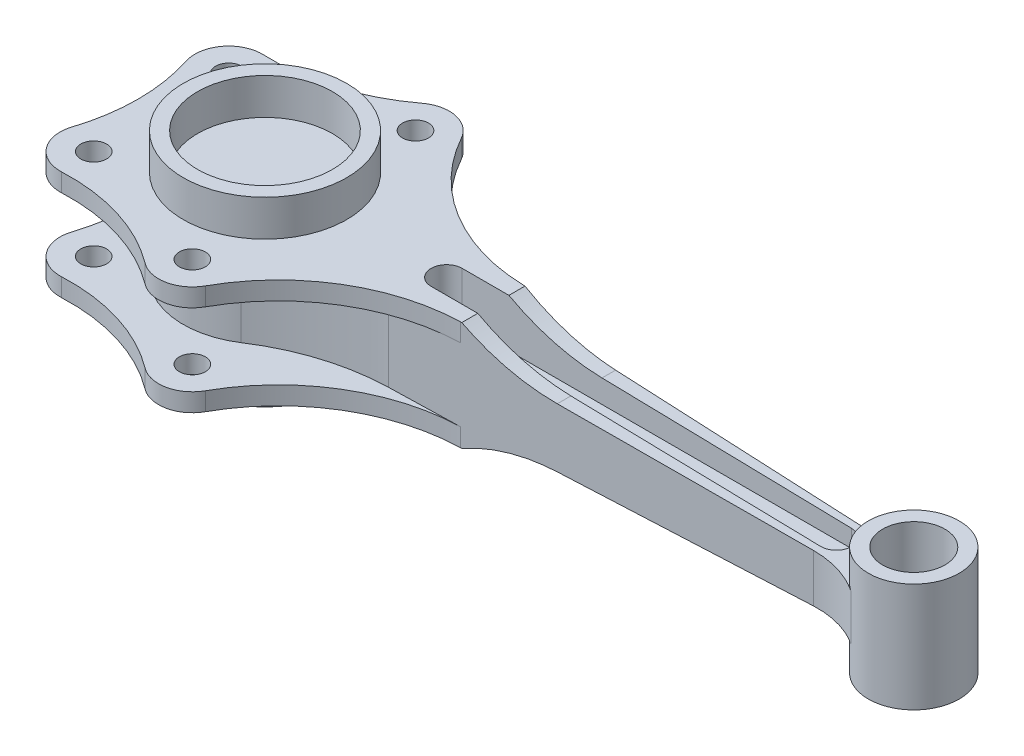
from build123d import *
from build123d.topology import SkipClean

# Parameters (mm, degrees)
BOSS_EXTRUDE1_DEPTH = 21
SKETCH2_R           = 12
CUT_EXTRUDE1_DEPTH  = 21
SKETCH3_R           = 26
CUT_EXTRUDE2_DEPTH  = 273.603191471
SKETCH5_R           = 31.5
SKETCH5_R_2         = 26
BOSS_EXTRUDE2_DEPTH = 35
SKETCH4_R           = 5
BOSS_EXTRUDE3_DEPTH = 7
CUT_EXTRUDE3_DEPTH  = 20
CUT_EXTRUDE5_REACH  = 280.977
CUT_EXTRUDE6_REACH  = 280.977
CUT_EXTRUDE7_START  = -2.5
CUT_EXTRUDE7_DEPTH  = 274.030851267


with BuildPart() as part:
    # Sketch1 → Boss-Extrude1 (new, symmetric)
    with BuildSketch(Plane(origin=(0, 0, 0), x_dir=(1, 0, 0), z_dir=(0, 1, 0))):
        with BuildLine():
            Line((60.430871603, 12.898377286), (220, 8.719912605))
            ThreePointArc((220, 8.719912605), (230.604685788, 10.075596562), (240.30539773, 14.569306326))
            ThreePointArc((240.30539773, 14.569306326), (267.5, 0), (240.30539773, -14.569306326))
            ThreePointArc((240.30539773, -14.569306326), (230.604685788, -10.075596562), (220, -8.719912605))
            Line((220, -8.719912605), (60.430871603, -12.898377286))
            ThreePointArc((60.430871603, -12.898377286), (37.890504435, -16.634432055), (17.222812986, -26.374698346))
            ThreePointArc((17.222812986, -26.374698346), (-31.5, 0), (17.222812986, 26.374698346))
            ThreePointArc((17.222812986, 26.374698346), (37.890504435, 16.634432055), (60.430871603, 12.898377286))
        make_face()
    extrude(amount=BOSS_EXTRUDE1_DEPTH, both=True)

    # Sketch2 → Cut-Extrude1 (cut, symmetric)
    with BuildSketch(Plane(origin=(0, 0, 0), x_dir=(1, 0, 0), z_dir=(0, 1, 0))):
        with Locations((250, 0)):
            Circle(SKETCH2_R)
    extrude(amount=CUT_EXTRUDE1_DEPTH, both=True, mode=Mode.SUBTRACT)

    # Sketch3 → Cut-Extrude2 (cut, through all)
    with BuildSketch(Plane.XZ.offset(21)):
        Circle(SKETCH3_R)
    extrude(amount=-CUT_EXTRUDE2_DEPTH, mode=Mode.SUBTRACT)

    # Sketch5 → Boss-Extrude2 (add, symmetric)
    with BuildSketch(Plane(origin=(0, 0, 0), x_dir=(1, 0, 0), z_dir=(0, 1, 0))):
        Circle(SKETCH5_R)
        Circle(SKETCH5_R_2, mode=Mode.SUBTRACT)
    extrude(amount=BOSS_EXTRUDE2_DEPTH, both=True)

    # Sketch4 → Boss-Extrude3 (add)
    with BuildSketch(Plane.XZ.offset(21)):
        with BuildLine():
            Line((87.482015231, 12.190018161), (87.482015231, -12.190018161))
            ThreePointArc((87.482015231, -12.190018161), (51.997088566, -22.622612499), (26.373739078, -49.29587638))
            ThreePointArc((26.373739078, -49.29587638), (17.709961948, -55.714405462), (7.181946677, -53.386435492))
            ThreePointArc((7.181946677, -53.386435492), (-14.855989459, -42.122318837), (-39.406288617, -38.986435492))
            ThreePointArc((-39.406288617, -38.986435492), (-50.326951915, -33.896458963), (-52.376901133, -22.023529412))
            ThreePointArc((-52.376901133, -22.023529412), (-48.925892025, 0), (-52.376901133, 22.023529412))
            ThreePointArc((-52.376901133, 22.023529412), (-50.326951915, 33.896458963), (-39.406288617, 38.986435492))
            ThreePointArc((-39.406288617, 38.986435492), (-14.855989459, 42.122318837), (7.181946677, 53.386435492))
            ThreePointArc((7.181946677, 53.386435492), (17.709961948, 55.714405462), (26.373739078, 49.29587638))
            ThreePointArc((26.373739078, 49.29587638), (51.997088566, 22.622612499), (87.482015231, 12.190018161))
        make_face()
        with Locations((15, 43)):
            Circle(SKETCH4_R, mode=Mode.SUBTRACT)
        with Locations((-40, 26)):
            Circle(SKETCH4_R, mode=Mode.SUBTRACT)
        with Locations((15, -43)):
            Circle(SKETCH4_R, mode=Mode.SUBTRACT)
        with Locations((-40, -26)):
            Circle(SKETCH4_R, mode=Mode.SUBTRACT)
    boss_extrude3 = extrude(amount=-BOSS_EXTRUDE3_DEPTH)

    # Mirror1: Boss-Extrude3 across plane
    add(boss_extrude3.mirror(Plane.ZX))

    # Sketch6 → Cut-Extrude3 (cut, symmetric)
    with BuildSketch(Plane.XY):
        with BuildLine():
            Line((123.875759549, 11.370189358), (232.5, 9))
            Line((232.5, 9), (232.5, 21))
            Line((232.5, 21), (88, 21))
            ThreePointArc((88, 21), (105.356268471, 14.018307807), (123.875759549, 11.370189358))
        make_face()
    cut_extrude3 = extrude(amount=CUT_EXTRUDE3_DEPTH, both=True, mode=Mode.SUBTRACT)

    # Mirror2: Cut-Extrude3 across plane
    add(cut_extrude3.mirror(Plane.ZX), mode=Mode.SUBTRACT)

    # Cut-Extrude5: up to this plane
    cut_extrude5_end = Plane(origin=(123.875759549, 11.370189358, -20), z_dir=(-0.021814885034561058, -0.9997620270799091, 0))
    # Sketch7 → Cut-Extrude5 (cut, up to the surface)
    with BuildSketch(Plane(origin=(0, 21, 0), x_dir=(1, 0, 0), z_dir=(0, 1, 0)), mode=Mode.PRIVATE) as cut_extrude5_sk1:
        with BuildLine():
            Line((232.5, 10.680424072), (232.5, 0))
            ThreePointArc((232.5, 0), (234.574282193, 8.264213825), (240.30539773, 14.569306326))
            ThreePointArc((240.30539773, 14.569306326), (236.524290746, 12.380817442), (232.5, 10.680424072))
        make_face()
    cut_extrude5_tool1 = split(extrude(cut_extrude5_sk1.sketch, amount=-CUT_EXTRUDE5_REACH, mode=Mode.PRIVATE), bisect_by=cut_extrude5_end, keep=Keep.BOTH, mode=Mode.PRIVATE)
    cut_extrude5 = cut_extrude5_tool1.solids().sort_by_distance((234.203382, 21, -9.039339))[0]
    add(cut_extrude5, mode=Mode.SUBTRACT)

    # Mirror10: Cut-Extrude5 across plane
    with SkipClean():  # the faces are left unmerged after this step: merging them gives an invalid solid
        add(cut_extrude5.mirror(Plane.XY), mode=Mode.SUBTRACT)

    # Cut-Extrude6: up to this plane
    with SkipClean():  # the faces are left unmerged after this step: merging them gives an invalid solid
        cut_extrude6_end = Plane(origin=(123.875759549, -11.370189358, -20), z_dir=(0.021814885034561058, -0.9997620270799091, 0))
        # Sketch9 → Cut-Extrude6 (cut, up to the surface)
        with BuildSketch(Plane.XZ.offset(21), mode=Mode.PRIVATE) as cut_extrude6_sk1:
            with BuildLine():
                Line((232.5, 10.680424072), (232.5, 0))
                ThreePointArc((232.5, 0), (234.574282193, 8.264213825), (240.30539773, 14.569306326))
                ThreePointArc((240.30539773, 14.569306326), (236.524290746, 12.380817442), (232.5, 10.680424072))
            make_face()
        cut_extrude6_tool1 = split(extrude(cut_extrude6_sk1.sketch, amount=-CUT_EXTRUDE6_REACH, mode=Mode.PRIVATE), bisect_by=cut_extrude6_end, keep=Keep.BOTH, mode=Mode.PRIVATE)
        add(cut_extrude6_tool1.solids().sort_by_distance((234.203382, -21, 9.039339))[0], mode=Mode.SUBTRACT)
        # Sketch9 → Cut-Extrude6 (cut, up to the surface)
        with BuildSketch(Plane.XZ.offset(21), mode=Mode.PRIVATE) as cut_extrude6_sk2:
            with BuildLine():
                Line((232.5, 0), (232.5, -10.680424072))
                ThreePointArc((232.5, -10.680424072), (236.524290746, -12.380817442), (240.30539773, -14.569306326))
                ThreePointArc((240.30539773, -14.569306326), (234.574282193, -8.264213825), (232.5, 0))
            make_face()
        cut_extrude6_tool2 = split(extrude(cut_extrude6_sk2.sketch, amount=-CUT_EXTRUDE6_REACH, mode=Mode.PRIVATE), bisect_by=cut_extrude6_end, keep=Keep.BOTH, mode=Mode.PRIVATE)
        add(cut_extrude6_tool2.solids().sort_by_distance((234.203382, -21, -9.039339))[0], mode=Mode.SUBTRACT)

    # Sketch10 → Cut-Extrude7 (cut, through all)
    with SkipClean():  # the faces are left unmerged after this step: merging them gives an invalid solid
        with BuildSketch(Plane(origin=(0, 0, 0), x_dir=(1, 0, 0), z_dir=(0, 1, 0)).offset(CUT_EXTRUDE7_START)):
            with BuildLine():
                Line((220, -6), (70, -6))
                ThreePointArc((70, -6), (64, 0), (70, 6))
                Line((70, 6), (220, 6))
                ThreePointArc((220, 6), (226, 0), (220, -6))
            make_face()
        cut_extrude7 = extrude(amount=-CUT_EXTRUDE7_DEPTH, mode=Mode.SUBTRACT)

    # Mirror11: Cut-Extrude7 across plane
    with SkipClean():  # the faces are left unmerged after this step: merging them gives an invalid solid
        add(cut_extrude7.mirror(Plane.ZX), mode=Mode.SUBTRACT)


solid = part.part
